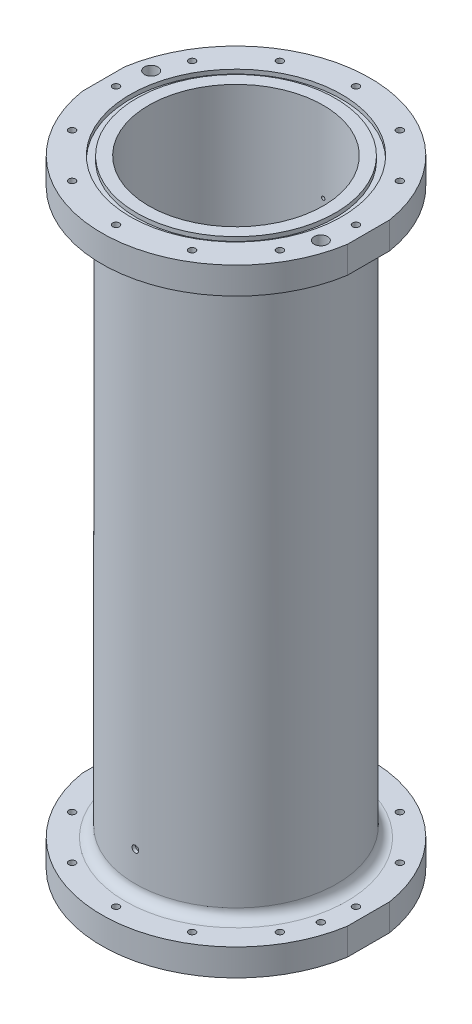
from build123d import *

# Parameters (mm, degrees)
SKETCH2_R                               = 47.625
SKETCH2_R_2                             = 41.275
BASE_CYLINDER_DEPTH                     = 292.1
SKETCH3_R                               = 63.5
SKETCH3_R_2                             = 41.275
AFT_FLANGE_DEPTH                        = 12.7
FORWARD_START                           = -12.7
SKETCH4_R                               = 63.5
SKETCH4_R_2                             = 41.275
FORWARD_FLANGE_DEPTH                    = 12.7
SKETCH6_R                               = 50.0761
SKETCH6_R_2                             = 47.0027
AFT_O_RING_DEPTH                        = 1.9812
FORWARD_START_2                         = -1.9812
SKETCH7_R                               = 50.0761
SKETCH7_R_2                             = 47.0027
FORWARD_O_RING_DEPTH                    = 1.9812
F_1_8_0_125_DIAMETER_HOLE2_AT_2_COUNT   = 2
F_1_8_0_125_DIAMETER_HOLE2_AT_2_PITCH   = 29.385796743
F_1_8_0_125_DIAMETER_HOLE2_AT_3_COUNT   = 2
F_1_8_0_125_DIAMETER_HOLE2_AT_3_PITCH   = 56.769
F_1_8_0_125_DIAMETER_HOLE2_AT_4_COUNT   = 2
F_1_8_0_125_DIAMETER_HOLE2_AT_4_PITCH   = 80.283489722
F_1_8_0_125_DIAMETER_HOLE2_AT_5_COUNT   = 2
F_1_8_0_125_DIAMETER_HOLE2_AT_5_PITCH   = 98.326792295
F_1_8_0_125_DIAMETER_HOLE2_AT_6_COUNT   = 2
F_1_8_0_125_DIAMETER_HOLE2_AT_6_PITCH   = 109.669286465
F_1_8_0_125_DIAMETER_HOLE2_AT_7_COUNT   = 2
F_1_8_0_125_DIAMETER_HOLE2_AT_7_PITCH   = 113.538
F_1_8_0_125_DIAMETER_HOLE2_AT_8_COUNT   = 2
F_1_8_0_125_DIAMETER_HOLE2_AT_8_PITCH   = 109.669286465
F_1_8_0_125_DIAMETER_HOLE2_AT_9_COUNT   = 2
F_1_8_0_125_DIAMETER_HOLE2_AT_9_PITCH   = 98.326792295
F_1_8_0_125_DIAMETER_HOLE2_AT_10_COUNT  = 2
F_1_8_0_125_DIAMETER_HOLE2_AT_10_PITCH  = 80.283489722
F_1_8_0_125_DIAMETER_HOLE2_AT_11_COUNT  = 2
F_1_8_0_125_DIAMETER_HOLE2_AT_11_PITCH  = 56.769
F_1_8_0_125_DIAMETER_HOLE2_AT_12_COUNT  = 2
F_1_8_0_125_DIAMETER_HOLE2_AT_12_PITCH  = 29.385796743
FLANGE_FILLET_R                         = 4.7625
F_1_4_0_25_PRESS_DOWEL_HOLE1_AT_2_COUNT = 2
F_1_4_0_25_PRESS_DOWEL_HOLE1_AT_2_PITCH = 113.538
F_1_8_0_125_DIAMETER_HOLE4_REACH        = 307.593
F_1_8_0_125_DIAMETER_HOLE4_BORE_R       = 1.5875
PRESSURETAP1_START                      = 46.0375
PRESSURETAP1_OUTLINE_R                  = 1.5875
PRESSURETAP1_DEPTH                      = 1.587500078
PRESSURETAP1_START_2                    = 41.273091803
PRESSURETAP1_2_OUTLINE_R                = 0.396875
PRESSURETAP1_2_DEPTH                    = 4.764408197
PRESSURETAP2_START                      = -47.6250001
PRESSURETAP2_OUTLINE_R                  = 1.5875
PRESSURETAP2_DEPTH                      = 3.1750001
PRESSURETAP2_START_2                    = -44.45
PRESSURETAP2_2_OUTLINE_R                = 0.79375
PRESSURETAP2_2_DEPTH                    = 3.18263301
MILLGRIPS_DEPTH                         = 306.59271925
MILLGRIPS_DEPTH_BACK                    = 306.59271925
SKETCH32_W                              = 1.5875
SKETCH32_H                              = 73.534943204


# Read off the part's stored shape, not the designer's step: PressureTap1, PressureTap2
with BuildPart() as part:
    # Sketch2 → Base Cylinder (new body)
    with BuildSketch(Plane(origin=(0, 0, 0), x_dir=(1, 0, 0), z_dir=(0, 1, 0))):
        with Locations(Location((0, 0, 0), (0, 0, 270))):
            Circle(SKETCH2_R)
        with Locations(Location((0, 0, 0), (0, 0, 270))):
            Circle(SKETCH2_R_2, mode=Mode.SUBTRACT)
    extrude(amount=BASE_CYLINDER_DEPTH)

    # Sketch3 → Aft Flange (add)
    with BuildSketch(Plane.XZ):
        with Locations(Location((0, 0, 0), (0, 0, 270))):
            Circle(SKETCH3_R)
        with Locations(Location((0, 0, 0), (0, 0, 90))):
            Circle(SKETCH3_R_2, mode=Mode.SUBTRACT)
    extrude(amount=-AFT_FLANGE_DEPTH)

    # Sketch4 → Forward Flange (add)
    with BuildSketch(Plane(origin=(0, 292.1, 0), x_dir=(1, 0, 0), z_dir=(0, 1, 0)).offset(FORWARD_START)):
        with Locations(Location((0, 0, 0), (0, 0, 90))):
            Circle(SKETCH4_R)
        with Locations(Location((0, 0, 0), (0, 0, 270))):
            Circle(SKETCH4_R_2, mode=Mode.SUBTRACT)
    extrude(amount=FORWARD_FLANGE_DEPTH)

    # Sketch6 → Aft O-Ring (cut)
    with BuildSketch(Plane.XZ):
        with Locations(Location((0, 0, 0), (0, 0, 270))):
            Circle(SKETCH6_R)
        with Locations(Location((0, 0, 0), (0, 0, 270))):
            Circle(SKETCH6_R_2, mode=Mode.SUBTRACT)
    extrude(amount=-AFT_O_RING_DEPTH, mode=Mode.SUBTRACT)

    # Sketch7 → Forward O-Ring (cut)
    with BuildSketch(Plane(origin=(0, 292.1, 0), x_dir=(1, 0, 0), z_dir=(0, 1, 0)).offset(FORWARD_START_2)):
        with Locations(Location((0, 0, 0), (0, 0, 90))):
            Circle(SKETCH7_R)
        with Locations(Location((0, 0, 0), (0, 0, 90))):
            Circle(SKETCH7_R_2, mode=Mode.SUBTRACT)
    extrude(amount=FORWARD_O_RING_DEPTH, mode=Mode.SUBTRACT)

    # Sketch9 → 1/8 (0.125) Diameter Hole2 (revolve, cut)
    with BuildSketch(Plane(origin=(28.3845, 0, 49.163396147), x_dir=(0, 0, -1), z_dir=(1, 0, 0))):
        Polygon((0, 0), (0, 26.353866233), (1.5875, 25.4), (1.5875, 0), align=None)
    f_1_8_0_125_diameter_hole2 = revolve(axis=Axis((28.3845, -6.35, 49.163396147), (0, 1, 0)), mode=Mode.SUBTRACT)

    # 1/8 (0.125) Diameter Hole2 at 2: 1/8 (0.125) Diameter Hole2 ×2
    with Locations(*[Vector(0.7071067811865477, 0, -0.7071067811865475) * (i * F_1_8_0_125_DIAMETER_HOLE2_AT_2_PITCH) for i in range(1, F_1_8_0_125_DIAMETER_HOLE2_AT_2_COUNT)]):
        add(f_1_8_0_125_diameter_hole2, mode=Mode.SUBTRACT)

    # 1/8 (0.125) Diameter Hole2 at 3: 1/8 (0.125) Diameter Hole2 ×2
    with Locations(*[Vector(0.5000000000000002, 0, -0.8660254037844386) * (i * F_1_8_0_125_DIAMETER_HOLE2_AT_3_PITCH) for i in range(1, F_1_8_0_125_DIAMETER_HOLE2_AT_3_COUNT)]):
        add(f_1_8_0_125_diameter_hole2, mode=Mode.SUBTRACT)

    # 1/8 (0.125) Diameter Hole2 at 4: 1/8 (0.125) Diameter Hole2 ×2
    with Locations(*[Vector(0.2588190451025211, 0, -0.9659258262890682) * (i * F_1_8_0_125_DIAMETER_HOLE2_AT_4_PITCH) for i in range(1, F_1_8_0_125_DIAMETER_HOLE2_AT_4_COUNT)]):
        add(f_1_8_0_125_diameter_hole2, mode=Mode.SUBTRACT)

    # 1/8 (0.125) Diameter Hole2 at 5: 1/8 (0.125) Diameter Hole2 ×2
    with Locations(*[(0, 0, -i * F_1_8_0_125_DIAMETER_HOLE2_AT_5_PITCH) for i in range(1, F_1_8_0_125_DIAMETER_HOLE2_AT_5_COUNT)]):
        add(f_1_8_0_125_diameter_hole2, mode=Mode.SUBTRACT)

    # 1/8 (0.125) Diameter Hole2 at 6: 1/8 (0.125) Diameter Hole2 ×2
    with Locations(*[Vector(-0.2588190451025206, 0, -0.9659258262890684) * (i * F_1_8_0_125_DIAMETER_HOLE2_AT_6_PITCH) for i in range(1, F_1_8_0_125_DIAMETER_HOLE2_AT_6_COUNT)]):
        add(f_1_8_0_125_diameter_hole2, mode=Mode.SUBTRACT)

    # 1/8 (0.125) Diameter Hole2 at 7: 1/8 (0.125) Diameter Hole2 ×2
    with Locations(*[Vector(-0.4999999999999996, 0, -0.8660254037844389) * (i * F_1_8_0_125_DIAMETER_HOLE2_AT_7_PITCH) for i in range(1, F_1_8_0_125_DIAMETER_HOLE2_AT_7_COUNT)]):
        add(f_1_8_0_125_diameter_hole2, mode=Mode.SUBTRACT)

    # 1/8 (0.125) Diameter Hole2 at 8: 1/8 (0.125) Diameter Hole2 ×2
    with Locations(*[Vector(-0.7071067811865474, 0, -0.7071067811865478) * (i * F_1_8_0_125_DIAMETER_HOLE2_AT_8_PITCH) for i in range(1, F_1_8_0_125_DIAMETER_HOLE2_AT_8_COUNT)]):
        add(f_1_8_0_125_diameter_hole2, mode=Mode.SUBTRACT)

    # 1/8 (0.125) Diameter Hole2 at 9: 1/8 (0.125) Diameter Hole2 ×2
    with Locations(*[Vector(-0.8660254037844386, 0, -0.5000000000000001) * (i * F_1_8_0_125_DIAMETER_HOLE2_AT_9_PITCH) for i in range(1, F_1_8_0_125_DIAMETER_HOLE2_AT_9_COUNT)]):
        add(f_1_8_0_125_diameter_hole2, mode=Mode.SUBTRACT)

    # 1/8 (0.125) Diameter Hole2 at 10: 1/8 (0.125) Diameter Hole2 ×2
    with Locations(*[Vector(-0.9659258262890683, 0, -0.2588190451025209) * (i * F_1_8_0_125_DIAMETER_HOLE2_AT_10_PITCH) for i in range(1, F_1_8_0_125_DIAMETER_HOLE2_AT_10_COUNT)]):
        add(f_1_8_0_125_diameter_hole2, mode=Mode.SUBTRACT)

    # 1/8 (0.125) Diameter Hole2 at 11: 1/8 (0.125) Diameter Hole2 ×2
    with Locations(*[(-i * F_1_8_0_125_DIAMETER_HOLE2_AT_11_PITCH, 0, 0) for i in range(1, F_1_8_0_125_DIAMETER_HOLE2_AT_11_COUNT)]):
        add(f_1_8_0_125_diameter_hole2, mode=Mode.SUBTRACT)

    # 1/8 (0.125) Diameter Hole2 at 12: 1/8 (0.125) Diameter Hole2 ×2
    with Locations(*[Vector(-0.9659258262890684, 0, 0.2588190451025204) * (i * F_1_8_0_125_DIAMETER_HOLE2_AT_12_PITCH) for i in range(1, F_1_8_0_125_DIAMETER_HOLE2_AT_12_COUNT)]):
        add(f_1_8_0_125_diameter_hole2, mode=Mode.SUBTRACT)

    # Flange Fillet
    flange_fillet_edges = [part.edges().sort_by_distance(p)[0] for p in [
        (0, 12.7, -47.625),
        (0, 279.4, -47.625),
    ]]
    fillet(flange_fillet_edges, radius=FLANGE_FILLET_R)

    # Sketch12 → 1/4 (0.25) Press Dowel Hole1 (revolve, cut)
    with BuildSketch(Plane(origin=(-54.834643233, 0, -14.692898371), x_dir=(0, 0, -1), z_dir=(1, 0, 0))):
        Polygon((0, 0), (0, 8.257732465), (3.175, 6.35), (3.175, 0), align=None)
    f_1_4_0_25_press_dowel_hole1 = revolve(axis=Axis((-54.834643233, -6.35, -14.692898371), (0, 1, 0)), mode=Mode.SUBTRACT)

    # 1/4 (0.25) Press Dowel Hole1 at 2: 1/4 (0.25) Press Dowel Hole1 ×2
    with Locations(*[Vector(0.9659258262890678, 0, 0.2588190451025227) * (i * F_1_4_0_25_PRESS_DOWEL_HOLE1_AT_2_PITCH) for i in range(1, F_1_4_0_25_PRESS_DOWEL_HOLE1_AT_2_COUNT)]):
        add(f_1_4_0_25_press_dowel_hole1, mode=Mode.SUBTRACT)

    # 1/8 (0.125) Diameter Hole4 bore → 1/8 (0.125) Diameter Hole4 (cut, up to next)
    with BuildSketch(Plane(origin=(0, 0, 0), x_dir=(-1, 0, 0), z_dir=(0, -1, 0)), mode=Mode.PRIVATE) as f_1_8_0_125_diameter_hole4_sk1:
        with Locations((-54.834643233, -14.692898371)):
            Circle(F_1_8_0_125_DIAMETER_HOLE4_BORE_R)
    f_1_8_0_125_diameter_hole4_tool1 = extrude(f_1_8_0_125_diameter_hole4_sk1.sketch, amount=-F_1_8_0_125_DIAMETER_HOLE4_REACH, mode=Mode.PRIVATE) & part.part
    # 1/8 (0.125) Diameter Hole4 bore → 1/8 (0.125) Diameter Hole4 (cut, up to next)
    with BuildSketch(Plane(origin=(0, 0, 0), x_dir=(-1, 0, 0), z_dir=(0, -1, 0)), mode=Mode.PRIVATE) as f_1_8_0_125_diameter_hole4_sk2:
        with Locations((54.834643233, 14.692898371)):
            Circle(F_1_8_0_125_DIAMETER_HOLE4_BORE_R)
    f_1_8_0_125_diameter_hole4_tool2 = extrude(f_1_8_0_125_diameter_hole4_sk2.sketch, amount=-F_1_8_0_125_DIAMETER_HOLE4_REACH, mode=Mode.PRIVATE) & part.part
    f_1_8_0_125_diameter_hole4_1 = f_1_8_0_125_diameter_hole4_tool1.solids().sort_by_distance((54.834643, 0, 14.692898))[0]
    add(f_1_8_0_125_diameter_hole4_1, mode=Mode.SUBTRACT)
    f_1_8_0_125_diameter_hole4_2 = f_1_8_0_125_diameter_hole4_tool2.solids().sort_by_distance((-54.834643, 0, -14.692898))[0]
    add(f_1_8_0_125_diameter_hole4_2, mode=Mode.SUBTRACT)
    f_1_8_0_125_diameter_hole4 = f_1_8_0_125_diameter_hole4_1 + f_1_8_0_125_diameter_hole4_2  # 1/8 (0.125) Diameter Hole4 as one shape, for the pattern or mirror that repeats it

    # Forward Mirror BC and Pin: 1/8 (0.125) Diameter Hole2, 1/4 (0.25) Press Dowel Hole1, 1/8 (0.125) Diameter Hole4 across plane
    add(f_1_8_0_125_diameter_hole2.mirror(Plane.ZX.offset(146.05)), mode=Mode.SUBTRACT)
    add(f_1_4_0_25_press_dowel_hole1.mirror(Plane.ZX.offset(146.05)), mode=Mode.SUBTRACT)
    add(f_1_8_0_125_diameter_hole4.mirror(Plane.ZX.offset(146.05)), mode=Mode.SUBTRACT)

    # Forward Mirror BC and Pin copy 1 sketch → Forward Mirror BC and Pin copy 1 (revolve, cut)
    with BuildSketch(Plane(origin=(49.163396147, 292.1, 28.3845), x_dir=(0, 0, -1), z_dir=(1, 0, 0))):
        Polygon((0, 0), (0, -26.353866233), (1.5875, -25.4), (1.5875, 0), align=None)
    revolve(axis=Axis((49.163396147, 298.45, 28.3845), (0, 1, 0)), mode=Mode.SUBTRACT)

    # Forward Mirror BC and Pin copy 2 sketch → Forward Mirror BC and Pin copy 2 (revolve, cut)
    with BuildSketch(Plane(origin=(56.769, 292.1, 0), x_dir=(0, 0, -1), z_dir=(1, 0, 0))):
        Polygon((0, 0), (0, -26.353866233), (1.5875, -25.4), (1.5875, 0), align=None)
    revolve(axis=Axis((56.769, 298.45, 0), (0, 1, 0)), mode=Mode.SUBTRACT)

    # Forward Mirror BC and Pin copy 3 sketch → Forward Mirror BC and Pin copy 3 (revolve, cut)
    with BuildSketch(Plane(origin=(49.163396147, 292.1, -28.3845), x_dir=(0, 0, -1), z_dir=(1, 0, 0))):
        Polygon((0, 0), (0, -26.353866233), (1.5875, -25.4), (1.5875, 0), align=None)
    revolve(axis=Axis((49.163396147, 298.45, -28.3845), (0, 1, 0)), mode=Mode.SUBTRACT)

    # Forward Mirror BC and Pin copy 4 sketch → Forward Mirror BC and Pin copy 4 (revolve, cut)
    with BuildSketch(Plane(origin=(28.3845, 292.1, -49.163396147), x_dir=(0, 0, -1), z_dir=(1, 0, 0))):
        Polygon((0, 0), (0, -26.353866233), (1.5875, -25.4), (1.5875, 0), align=None)
    revolve(axis=Axis((28.3845, 298.45, -49.163396147), (0, 1, 0)), mode=Mode.SUBTRACT)

    # Forward Mirror BC and Pin copy 5 sketch → Forward Mirror BC and Pin copy 5 (revolve, cut)
    with BuildSketch(Plane(origin=(0, 292.1, -56.769), x_dir=(0, 0, -1), z_dir=(1, 0, 0))):
        Polygon((0, 0), (0, -26.353866233), (1.5875, -25.4), (1.5875, 0), align=None)
    revolve(axis=Axis((0, 298.45, -56.769), (0, 1, 0)), mode=Mode.SUBTRACT)

    # Forward Mirror BC and Pin copy 6 sketch → Forward Mirror BC and Pin copy 6 (revolve, cut)
    with BuildSketch(Plane(origin=(-28.3845, 292.1, -49.163396147), x_dir=(0, 0, -1), z_dir=(1, 0, 0))):
        Polygon((0, 0), (0, -26.353866233), (1.5875, -25.4), (1.5875, 0), align=None)
    revolve(axis=Axis((-28.3845, 298.45, -49.163396147), (0, 1, 0)), mode=Mode.SUBTRACT)

    # Forward Mirror BC and Pin copy 7 sketch → Forward Mirror BC and Pin copy 7 (revolve, cut)
    with BuildSketch(Plane(origin=(-49.163396147, 292.1, -28.3845), x_dir=(0, 0, -1), z_dir=(1, 0, 0))):
        Polygon((0, 0), (0, -26.353866233), (1.5875, -25.4), (1.5875, 0), align=None)
    revolve(axis=Axis((-49.163396147, 298.45, -28.3845), (0, 1, 0)), mode=Mode.SUBTRACT)

    # Forward Mirror BC and Pin copy 8 sketch → Forward Mirror BC and Pin copy 8 (revolve, cut)
    with BuildSketch(Plane(origin=(-56.769, 292.1, 0), x_dir=(0, 0, -1), z_dir=(1, 0, 0))):
        Polygon((0, 0), (0, -26.353866233), (1.5875, -25.4), (1.5875, 0), align=None)
    revolve(axis=Axis((-56.769, 298.45, 0), (0, 1, 0)), mode=Mode.SUBTRACT)

    # Forward Mirror BC and Pin copy 9 sketch → Forward Mirror BC and Pin copy 9 (revolve, cut)
    with BuildSketch(Plane(origin=(-49.163396147, 292.1, 28.3845), x_dir=(0, 0, -1), z_dir=(1, 0, 0))):
        Polygon((0, 0), (0, -26.353866233), (1.5875, -25.4), (1.5875, 0), align=None)
    revolve(axis=Axis((-49.163396147, 298.45, 28.3845), (0, 1, 0)), mode=Mode.SUBTRACT)

    # Forward Mirror BC and Pin copy 10 sketch → Forward Mirror BC and Pin copy 10 (revolve, cut)
    with BuildSketch(Plane(origin=(-28.3845, 292.1, 49.163396147), x_dir=(0, 0, -1), z_dir=(1, 0, 0))):
        Polygon((0, 0), (0, -26.353866233), (1.5875, -25.4), (1.5875, 0), align=None)
    revolve(axis=Axis((-28.3845, 298.45, 49.163396147), (0, 1, 0)), mode=Mode.SUBTRACT)

    # Forward Mirror BC and Pin copy 11 sketch → Forward Mirror BC and Pin copy 11 (revolve, cut)
    with BuildSketch(Plane(origin=(0, 292.1, 56.769), x_dir=(0, 0, -1), z_dir=(1, 0, 0))):
        Polygon((0, 0), (0, -26.353866233), (1.5875, -25.4), (1.5875, 0), align=None)
    revolve(axis=Axis((0, 298.45, 56.769), (0, 1, 0)), mode=Mode.SUBTRACT)

    # Forward Mirror BC and Pin copy 12 sketch → Forward Mirror BC and Pin copy 12 (revolve, cut)
    with BuildSketch(Plane(origin=(54.834643233, 292.1, 14.692898371), x_dir=(0, 0, -1), z_dir=(1, 0, 0))):
        Polygon((0, 0), (0, -8.257732465), (3.175, -6.35), (3.175, 0), align=None)
    revolve(axis=Axis((54.834643233, 298.45, 14.692898371), (0, 1, 0)), mode=Mode.SUBTRACT)

    # PressureTap1 outline → PressureTap1 (cut)
    with BuildSketch(Plane.XY.offset(PRESSURETAP1_START)):
        with Locations((0, 31.75)):
            Circle(PRESSURETAP1_OUTLINE_R)
    extrude(amount=PRESSURETAP1_DEPTH, mode=Mode.SUBTRACT)

    # PressureTap1 2 outline → PressureTap1 2 (cut)
    with BuildSketch(Plane.XY.offset(PRESSURETAP1_START_2)):
        with Locations((0, 31.75)):
            Circle(PRESSURETAP1_2_OUTLINE_R)
    extrude(amount=PRESSURETAP1_2_DEPTH, mode=Mode.SUBTRACT)

    # PressureTap2 outline → PressureTap2 (cut)
    with BuildSketch(Plane.XY.offset(PRESSURETAP2_START)):
        with Locations((0, 254)):
            Circle(PRESSURETAP2_OUTLINE_R)
    extrude(amount=PRESSURETAP2_DEPTH, mode=Mode.SUBTRACT)

    # PressureTap2 2 outline → PressureTap2 2 (cut)
    with BuildSketch(Plane.XY.offset(PRESSURETAP2_START_2)):
        with Locations((0, 254)):
            Circle(PRESSURETAP2_2_OUTLINE_R)
    extrude(amount=PRESSURETAP2_2_DEPTH, mode=Mode.SUBTRACT)

    # Sketch32 → MillGrips (cut, two sides: drawn at the far end of the back side and taken through both)
    with BuildSketch(Plane(origin=(0, 292.1, 0), x_dir=(1, 0, 0), z_dir=(0, 1, 0)).offset(-MILLGRIPS_DEPTH_BACK)):
        with Locations((-63.5, 0)):
            Rectangle(SKETCH32_W, SKETCH32_H)
        with Locations((63.5, 0)):
            Rectangle(SKETCH32_W, SKETCH32_H)
    extrude(amount=MILLGRIPS_DEPTH + MILLGRIPS_DEPTH_BACK, mode=Mode.SUBTRACT)


solid = part.part
